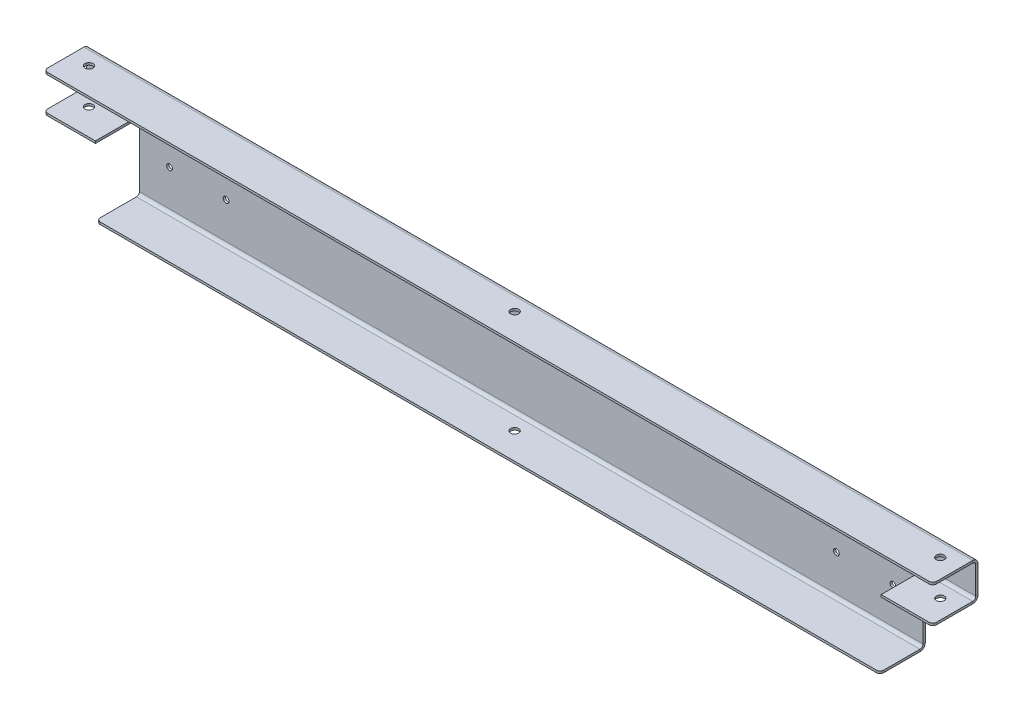
from build123d import *

# Parameters (mm, degrees)
BASE_FLANGE1_DEPTH               = 1.89738
EDGE_FLANGE1_DEPTH               = 749.3
EDGE_FLANGE1_2_DEPTH             = 44.47667
EDGE_FLANGE1_START               = 704.82333
EDGE_FLANGE1_3_DEPTH             = 44.47667
EDGE_FLANGE1_START_2             = 43.52798
EDGE_FLANGE1_4_DEPTH             = 0.94869
EDGE_FLANGE1_5_DEPTH             = 0.94869
EDGE_FLANGE1_START_3             = 44.45
EDGE_FLANGE1_6_DEPTH             = 660.4
EDGE_FLANGE1_7_DEPTH             = 749.3
EDGE_FLANGE1_8_DEPTH             = 43.52798
EDGE_FLANGE1_START_4             = 705.77202
EDGE_FLANGE1_9_DEPTH             = 43.52798
FILLET1_R                        = 3.175
F_10_0_1935_DIAMETER_HOLE1_D     = 4.9149
F_17_64_0_26563_DIAMETER_HOLE2_D = 6.747002


# Read off the part's stored shape, not the designer's step: Edge-Flange1
# Sheet-metal steps are written as plain solids
with BuildPart() as part:
    # Sketch1 → Base-Flange1 (new body)
    with BuildSketch(Plane.XY):
        Polygon((44.45, 19.05), (704.85, 19.05), (704.85, 76.2), (749.3, 76.2), (749.3, 107.95), (0, 107.95), (0, 76.2), (44.45, 76.2), align=None)
    extrude(amount=-BASE_FLANGE1_DEPTH)

    # Edge-Flange1 outline → Edge-Flange1 (cut)
    with BuildSketch(Plane.YZ):
        with BuildLine():
            Line((19.05, -1.89738), (23.48738, -1.89738))
            ThreePointArc((23.48738, -1.89738), (21.435625133, -1.394544857), (19.84887189, 0))
            Line((19.84887189, 0), (19.05, 0))
            Line((19.05, 0), (19.05, -1.89738))
        make_face()
        with BuildLine():
            ThreePointArc((107.15112811, 0), (105.564374867, -1.394544857), (103.51262, -1.89738))
            Line((103.51262, -1.89738), (107.95, -1.89738))
            Line((107.95, -1.89738), (107.95, 0))
            Line((107.95, 0), (107.15112811, 0))
        make_face()
    extrude(amount=EDGE_FLANGE1_DEPTH, mode=Mode.SUBTRACT)

    # Edge-Flange1 2 outline → Edge-Flange1 2 (cut)
    with BuildSketch(Plane.YZ):
        with BuildLine():
            Line((76.2, 0), (76.2, -1.89738))
            Line((76.2, -1.89738), (80.63738, -1.89738))
            ThreePointArc((80.63738, -1.89738), (78.585625133, -1.394544857), (76.99887189, 0))
            Line((76.99887189, 0), (76.2, 0))
        make_face()
    extrude(amount=EDGE_FLANGE1_2_DEPTH, mode=Mode.SUBTRACT)

    # Edge-Flange1 3 outline → Edge-Flange1 3 (cut)
    with BuildSketch(Plane.YZ.offset(EDGE_FLANGE1_START)):
        with BuildLine():
            Line((76.2, 0), (76.2, -1.89738))
            Line((76.2, -1.89738), (80.63738, -1.89738))
            ThreePointArc((80.63738, -1.89738), (78.585625133, -1.394544857), (76.99887189, 0))
            Line((76.99887189, 0), (76.2, 0))
        make_face()
    extrude(amount=EDGE_FLANGE1_3_DEPTH, mode=Mode.SUBTRACT)

    # Edge-Flange1 4 outline → Edge-Flange1 4 (cut)
    with BuildSketch(Plane.YZ.offset(EDGE_FLANGE1_START_2)):
        with BuildLine():
            ThreePointArc((76.99887189, 0), (78.585625133, -1.394544857), (80.63738, -1.89738))
            Line((80.63738, -1.89738), (81.58607, -1.89738))
            Line((81.58607, -1.89738), (81.58607, 0))
            Line((81.58607, 0), (76.99887189, 0))
        make_face()
    extrude(amount=EDGE_FLANGE1_4_DEPTH, mode=Mode.SUBTRACT)

    # Edge-Flange1 5 outline → Edge-Flange1 5 (cut)
    with BuildSketch(Plane.YZ.offset(EDGE_FLANGE1_START)):
        with BuildLine():
            ThreePointArc((76.99887189, 0), (78.585625133, -1.394544857), (80.63738, -1.89738))
            Line((80.63738, -1.89738), (81.58607, -1.89738))
            Line((81.58607, -1.89738), (81.58607, 0))
            Line((81.58607, 0), (76.99887189, 0))
        make_face()
    extrude(amount=EDGE_FLANGE1_5_DEPTH, mode=Mode.SUBTRACT)

    # Edge-Flange1 6 outline → Edge-Flange1 6 (add)
    with BuildSketch(Plane.YZ.offset(EDGE_FLANGE1_START_3)):
        with BuildLine():
            Line((19.84887189, 0), (23.48738, 0))
            ThreePointArc((23.48738, 0), (21.691328776, 0.743948776), (20.94738, 2.54))
            Line((20.94738, 2.54), (20.94738, 36.20262))
            Line((20.94738, 36.20262), (19.05, 36.20262))
            Line((19.05, 36.20262), (19.05, 2.54))
            ThreePointArc((19.05, 2.54), (19.254426871, 1.20866643), (19.84887189, 0))
        make_face()
        with BuildLine():
            ThreePointArc((106.05262, 2.54), (105.308671224, 0.743948776), (103.51262, 0))
            Line((103.51262, 0), (107.15112811, 0))
            ThreePointArc((107.15112811, 0), (107.745573129, 1.20866643), (107.95, 2.54))
            Line((107.95, 2.54), (107.95, 36.20262))
            Line((107.95, 36.20262), (106.05262, 36.20262))
            Line((106.05262, 36.20262), (106.05262, 2.54))
        make_face()
    extrude(amount=EDGE_FLANGE1_6_DEPTH)

    # Edge-Flange1 7 outline → Edge-Flange1 7 (add)
    with BuildSketch(Plane.YZ):
        with BuildLine():
            ThreePointArc((106.05262, 2.54), (105.308671224, 0.743948776), (103.51262, 0))
            Line((103.51262, 0), (107.15112811, 0))
            ThreePointArc((107.15112811, 0), (107.745573129, 1.20866643), (107.95, 2.54))
            Line((107.95, 2.54), (107.95, 36.20262))
            Line((107.95, 36.20262), (106.05262, 36.20262))
            Line((106.05262, 36.20262), (106.05262, 2.54))
        make_face()
    extrude(amount=EDGE_FLANGE1_7_DEPTH)

    # Edge-Flange1 8 outline → Edge-Flange1 8 (add)
    with BuildSketch(Plane.YZ):
        with BuildLine():
            ThreePointArc((76.2, 2.54), (76.404426871, 1.20866643), (76.99887189, 0))
            Line((76.99887189, 0), (80.63738, 0))
            ThreePointArc((80.63738, 0), (78.841328776, 0.743948776), (78.09738, 2.54))
            Line((78.09738, 2.54), (78.09738, 36.20262))
            Line((78.09738, 36.20262), (76.2, 36.20262))
            Line((76.2, 36.20262), (76.2, 2.54))
        make_face()
    extrude(amount=EDGE_FLANGE1_8_DEPTH)

    # Edge-Flange1 9 outline → Edge-Flange1 9 (add)
    with BuildSketch(Plane.YZ.offset(EDGE_FLANGE1_START_4)):
        with BuildLine():
            ThreePointArc((76.2, 2.54), (76.404426871, 1.20866643), (76.99887189, 0))
            Line((76.99887189, 0), (80.63738, 0))
            ThreePointArc((80.63738, 0), (78.841328776, 0.743948776), (78.09738, 2.54))
            Line((78.09738, 2.54), (78.09738, 36.20262))
            Line((78.09738, 36.20262), (76.2, 36.20262))
            Line((76.2, 36.20262), (76.2, 2.54))
        make_face()
    extrude(amount=EDGE_FLANGE1_9_DEPTH)

    # Fillet1
    fillet1_edges = [part.edges().sort_by_distance(p)[0] for p in [
        (749.3, 107.00131, 36.20262),
        (0, 107.00131, 36.20262),
        (0, 77.14869, 36.20262),
        (44.45, 19.99869, 36.20262),
        (704.85, 19.99869, 36.20262),
        (749.3, 77.14869, 36.20262),
    ]]
    fillet(fillet1_edges, radius=FILLET1_R)

    # #10 (0.1935) Diameter Hole1 (through all)
    with Locations(Plane(origin=(0, 0, -1.89738), x_dir=(-1, 0, 0), z_dir=(0, 0, -1))):
        with Locations((-679.45, 53.975), (-631.825, 53.975), (-117.475, 53.975), (-69.85, 53.975)):
            Hole(F_10_0_1935_DIAMETER_HOLE1_D / 2)

    # 17/64 (0.26563) Diameter Hole2 (through all)
    with Locations(Plane(origin=(0, 107.95, 0), x_dir=(1, 0, 0), z_dir=(0, 1, 0))):
        with Locations((733.425, -13.97762), (374.65, -13.97762), (15.875, -13.97762)):
            Hole(F_17_64_0_26563_DIAMETER_HOLE2_D / 2)


solid = part.part
